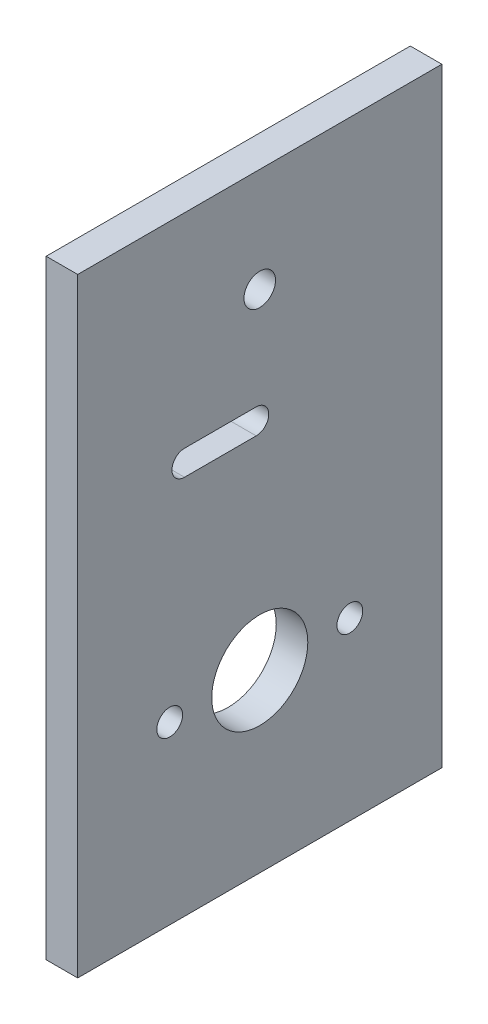
from build123d import *

# Parameters (mm, degrees)
SKETCH1_W           = 50.8
SKETCH1_H           = 85
BOSS_EXTRUDE1_DEPTH = 4.4
SKETCH2_R           = 2.2
SKETCH2_R_2         = 6.7
SKETCH2_R_3         = 1.8
CUT_EXTRUDE1_DEPTH  = 50.706840576
CUT_EXTRUDE2_DEPTH  = 50.706840576
SKETCH5_R           = 8
SKETCH5_R_2         = 4.25
BOSS_EXTRUDE2_DEPTH = 4.3
CHAMFER1_SIZE       = 1


with BuildPart() as part:
    # Sketch1 → Boss-Extrude1 (new body)
    with BuildSketch(Plane(origin=(0, 0, 0), x_dir=(0, 0, -1), z_dir=(1, 0, 0))):
        Rectangle(SKETCH1_W, SKETCH1_H)
    extrude(amount=BOSS_EXTRUDE1_DEPTH)

    # Sketch2 → Cut-Extrude1 (cut, through all)
    with BuildSketch(Plane(origin=(4.4, 0, 0), x_dir=(0, 0, -1), z_dir=(1, 0, 0))):
        with Locations((0, 27.999533123)):
            Circle(SKETCH2_R)
        with Locations((0, -18.000466877)):
            Circle(SKETCH2_R_2)
        with Locations((-12.565, -18.000466877)):
            Circle(SKETCH2_R_3)
        with Locations((12.565, -18.000466877)):
            Circle(SKETCH2_R_3)
    extrude(amount=-CUT_EXTRUDE1_DEPTH, mode=Mode.SUBTRACT)

    # Sketch4 → Cut-Extrude2 (cut, through all)
    with BuildSketch(Plane(origin=(4.4, 0, 0), x_dir=(0, 0, -1), z_dir=(1, 0, 0))):
        with BuildLine():
            Line((-10.5, 14.049533123), (-0.5, 14.049533123))
            ThreePointArc((-0.5, 14.049533123), (1.25, 12.299533123), (-0.5, 10.549533123))
            Line((-0.5, 10.549533123), (-10.5, 10.549533123))
            ThreePointArc((-10.5, 10.549533123), (-12.25, 12.299533123), (-10.5, 14.049533123))
        make_face()
    extrude(amount=-CUT_EXTRUDE2_DEPTH, mode=Mode.SUBTRACT)

    # Sketch5 → Boss-Extrude2 (add)
    with BuildSketch(Plane.ZY):
        with Locations((0, 27.999533123)):
            Circle(SKETCH5_R)
        with Locations((0, 27.999533123)):
            Circle(SKETCH5_R_2, mode=Mode.SUBTRACT)
    extrude(amount=BOSS_EXTRUDE2_DEPTH)

    # Chamfer1
    chamfer1_edges = [part.edges().sort_by_distance(p)[0] for p in [
        (0, 27.999533123, -8),
    ]]
    chamfer(chamfer1_edges, length=CHAMFER1_SIZE)


solid = part.part
